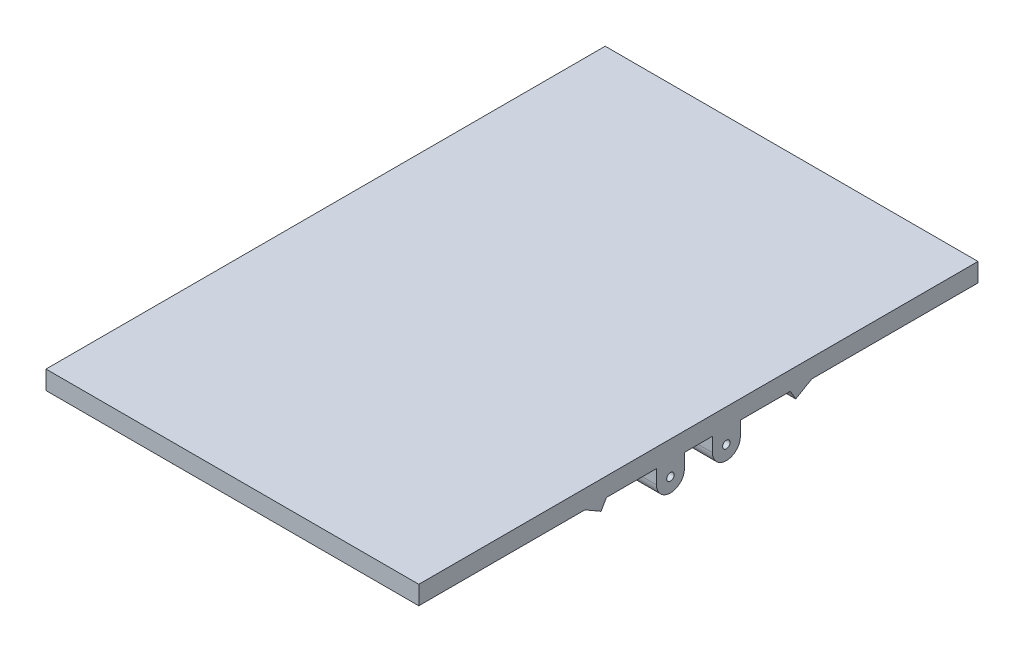
from build123d import *

# Parameters (mm, degrees)
SKETCH1_W            = 400
SKETCH1_H            = 600
BOSS_EXTRUDE1_DEPTH  = 20
BOSS_EXTRUDE2_DEPTH  = 30
MIRROR2_COPY_1_DEPTH = 30
BOSS_EXTRUDE3_DEPTH  = 40
MIRROR4_COPY_1_DEPTH = 40
CUT_EXTRUDE1_REACH   = 502.908
SKETCH5_R            = 4
CUT_EXTRUDE2_REACH   = 502.908
SKETCH6_R            = 4


with BuildPart() as part:
    # Sketch1 → Boss-Extrude1 (new body)
    with BuildSketch(Plane(origin=(0, 0, 0), x_dir=(1, 0, 0), z_dir=(0, 1, 0))):
        Rectangle(SKETCH1_W, SKETCH1_H)
    extrude(amount=BOSS_EXTRUDE1_DEPTH)

    # Sketch3 → Boss-Extrude2 (add)
    with BuildSketch(Plane(origin=(200, 0, 0), x_dir=(0, 0, -1), z_dir=(1, 0, 0))):
        with BuildLine():
            Line((-45, -15.146106113), (-45, 0))
            Line((-45, 0), (-15, 0))
            Line((-15, 0), (-15, -15.146106113))
            ThreePointArc((-15, -15.146106113), (-30, -30.146106113), (-45, -15.146106113))
        make_face()
    boss_extrude2 = extrude(amount=-BOSS_EXTRUDE2_DEPTH)

    # Mirror1: Boss-Extrude2 across plane
    add(boss_extrude2.mirror(Plane.XY))

    # Mirror2: Boss-Extrude2 across plane
    add(boss_extrude2.mirror(Plane(origin=(0, 0, 0), x_dir=(0, 0, 1), z_dir=(1, 0, 0))))

    # Mirror2 copy 1 sketch → Mirror2 copy 1 (add)
    with BuildSketch(Plane.ZY.offset(200)):
        with BuildLine():
            Line((-45, -15.146106113), (-45, 0))
            Line((-45, 0), (-15, 0))
            Line((-15, 0), (-15, -15.146106113))
            ThreePointArc((-15, -15.146106113), (-30, -30.146106113), (-45, -15.146106113))
        make_face()
    extrude(amount=-MIRROR2_COPY_1_DEPTH)

    # Sketch4 → Boss-Extrude3 (add)
    with BuildSketch(Plane(origin=(200, 0, 0), x_dir=(0, 0, -1), z_dir=(1, 0, 0))):
        Polygon((-121.760513267, 0), (-104.440005192, -10), (-98.6665025, 0), align=None)
    boss_extrude3 = extrude(amount=-BOSS_EXTRUDE3_DEPTH)

    # Mirror3: Boss-Extrude3 across plane
    add(boss_extrude3.mirror(Plane.XY))

    # Mirror4: Boss-Extrude3 across plane
    add(boss_extrude3.mirror(Plane(origin=(0, 0, 0), x_dir=(0, 0, 1), z_dir=(1, 0, 0))))

    # Mirror4 copy 1 sketch → Mirror4 copy 1 (add)
    with BuildSketch(Plane.ZY.offset(200)):
        Polygon((-121.760513267, 0), (-104.440005192, -10), (-98.6665025, 0), align=None)
    extrude(amount=-MIRROR4_COPY_1_DEPTH)

    # Sketch5 → Cut-Extrude1 (cut, up to next)
    with BuildSketch(Plane(origin=(200, 0, 0), x_dir=(0, 0, -1), z_dir=(1, 0, 0)), mode=Mode.PRIVATE) as cut_extrude1_sk1:
        with Locations((-30, -15.146106113)):
            Circle(SKETCH5_R)
    cut_extrude1_tool1 = extrude(cut_extrude1_sk1.sketch, amount=-CUT_EXTRUDE1_REACH, mode=Mode.PRIVATE) & part.part
    # Sketch5 → Cut-Extrude1 (cut, up to next)
    with BuildSketch(Plane(origin=(200, 0, 0), x_dir=(0, 0, -1), z_dir=(1, 0, 0)), mode=Mode.PRIVATE) as cut_extrude1_sk2:
        with Locations((30, -15.146106113)):
            Circle(SKETCH5_R)
    cut_extrude1_tool2 = extrude(cut_extrude1_sk2.sketch, amount=-CUT_EXTRUDE1_REACH, mode=Mode.PRIVATE) & part.part
    add(cut_extrude1_tool1.solids().sort_by_distance((200, -15.146106, 30))[0], mode=Mode.SUBTRACT)
    add(cut_extrude1_tool2.solids().sort_by_distance((200, -15.146106, -30))[0], mode=Mode.SUBTRACT)

    # Sketch6 → Cut-Extrude2 (cut, up to next)
    with BuildSketch(Plane.ZY.offset(200), mode=Mode.PRIVATE) as cut_extrude2_sk1:
        with Locations((-30, -15.146106113)):
            Circle(SKETCH6_R)
    cut_extrude2_tool1 = extrude(cut_extrude2_sk1.sketch, amount=-CUT_EXTRUDE2_REACH, mode=Mode.PRIVATE) & part.part
    # Sketch6 → Cut-Extrude2 (cut, up to next)
    with BuildSketch(Plane.ZY.offset(200), mode=Mode.PRIVATE) as cut_extrude2_sk2:
        with Locations((30, -15.146106113)):
            Circle(SKETCH6_R)
    cut_extrude2_tool2 = extrude(cut_extrude2_sk2.sketch, amount=-CUT_EXTRUDE2_REACH, mode=Mode.PRIVATE) & part.part
    add(cut_extrude2_tool1.solids().sort_by_distance((-200, -15.146106, -30))[0], mode=Mode.SUBTRACT)
    add(cut_extrude2_tool2.solids().sort_by_distance((-200, -15.146106, 30))[0], mode=Mode.SUBTRACT)


solid = part.part
